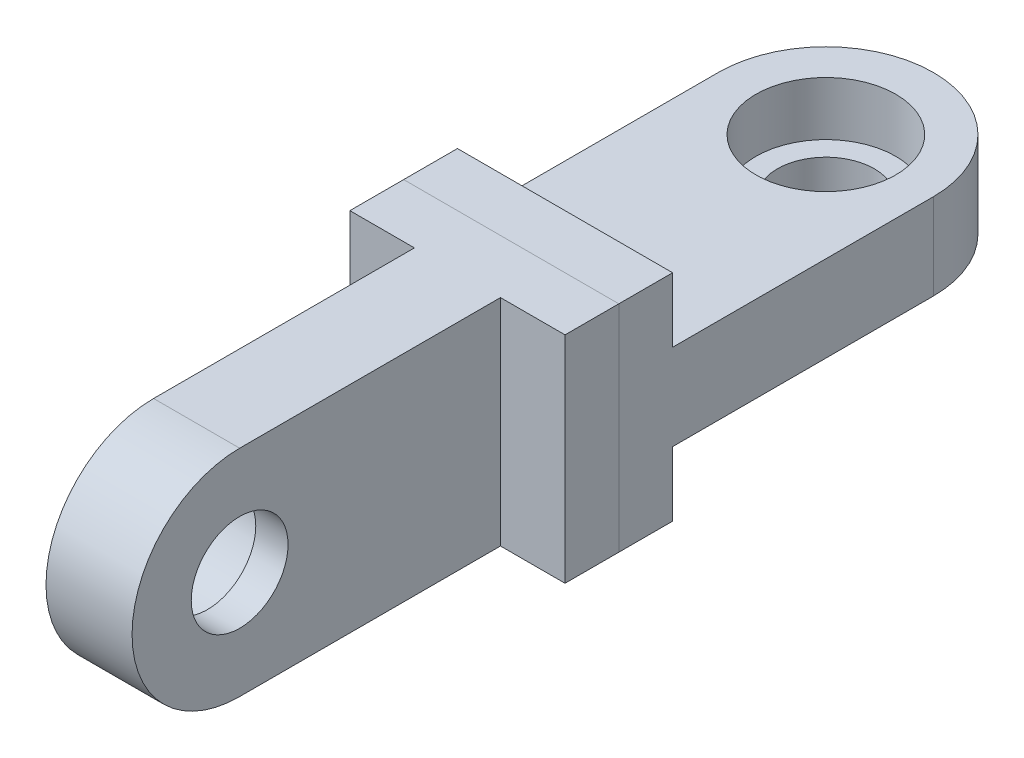
from build123d import *

# Parameters (mm, degrees)
SKETCH_1_W          = 20
SKETCH_1_H          = 20
EXTRUDE_1_DEPTH     = 80.297387422
SKETCH_7_W          = 35.148693711
SKETCH_7_H          = 6
CUT_EXTRUDE_6_DEPTH = 34
SKETCH_2_R          = 6.5
CUT_EXTRUDE_9_DEPTH = 5
SKETCH_3_R          = 4.5
CUT_EXTRUDE_2_DEPTH = 29
MOVE_BODY_1_ANGLE   = 90


# Read off the part's stored shape, not the designer's step: 교차3
with BuildPart() as part:
    # 스케치1 → 보스-돌출1 (new body)
    with BuildSketch(Plane.XY):
        Rectangle(SKETCH_1_W, SKETCH_1_H)
    extrude(amount=EXTRUDE_1_DEPTH)

    # 스케치7 → 컷-돌출6 (cut)
    with BuildSketch(Plane(origin=(10, 0, 0), x_dir=(0, 0, -1), z_dir=(1, 0, 0))):
        with Locations((-17.574346855, 7)):
            Rectangle(SKETCH_7_W, SKETCH_7_H)
        with Locations((-17.574346855, -7)):
            Rectangle(SKETCH_7_W, SKETCH_7_H)
    cut_extrude_6 = extrude(amount=-CUT_EXTRUDE_6_DEPTH, mode=Mode.SUBTRACT)

    # 스케치2 → 컷-돌출9 (cut)
    with BuildSketch(Plane(origin=(0, 4, 0), x_dir=(-1, 0, 0), z_dir=(0, -1, 0))):
        with Locations(Location((0, -10.902706153, 0), (0, 0, 90))):
            Circle(SKETCH_2_R)
    cut_extrude_9 = extrude(amount=CUT_EXTRUDE_9_DEPTH, mode=Mode.SUBTRACT)

    # 스케치3 → 컷-돌출2 (cut)
    with BuildSketch(Plane(origin=(0, -4, 0), x_dir=(-1, 0, 0), z_dir=(0, -1, 0))):
        with Locations(Location((0, -10.902706153, 0), (0, 0, 90))):
            Circle(SKETCH_3_R)
        with BuildLine():
            Line((-21.262122506, -10.902706153), (-10, -10.902706153))
            ThreePointArc((-10, -10.902706153), (0, -0.902706153), (10, -10.902706153))
            Line((10, -10.902706153), (21.262122506, -10.902706153))
            ThreePointArc((21.262122506, -10.902706153), (0, 10.359416353), (-21.262122506, -10.902706153))
        make_face()
    cut_extrude_2 = extrude(amount=-CUT_EXTRUDE_2_DEPTH, mode=Mode.SUBTRACT)

    # 대칭 복사6: 컷-돌출6, 컷-돌출9, 컷-돌출2 across plane
    add(cut_extrude_6.mirror(Plane.XY.offset(40.148693711)), mode=Mode.SUBTRACT)
    add(cut_extrude_9.mirror(Plane.XY.offset(40.148693711)), mode=Mode.SUBTRACT)
    add(cut_extrude_2.mirror(Plane.XY.offset(40.148693711)), mode=Mode.SUBTRACT)


with BuildPart() as body_2:
    # 교차3: the piece on the far side of the plane
    add(part.part)
    split(bisect_by=Plane.XY.offset(40.148693711), keep=Keep.BOTTOM)


with BuildPart() as part_1:
    add(part.part)

    # 교차3
    split(bisect_by=Plane.XY.offset(40.148693711), keep=Keep.TOP)


with BuildPart() as part_2:
    # Move Body 1: moved
    add(part_1.part.rotate(Axis((0, 0, 0), (0, 0, 1)), MOVE_BODY_1_ANGLE))


solid = Compound([body_2.part, part_2.part])
